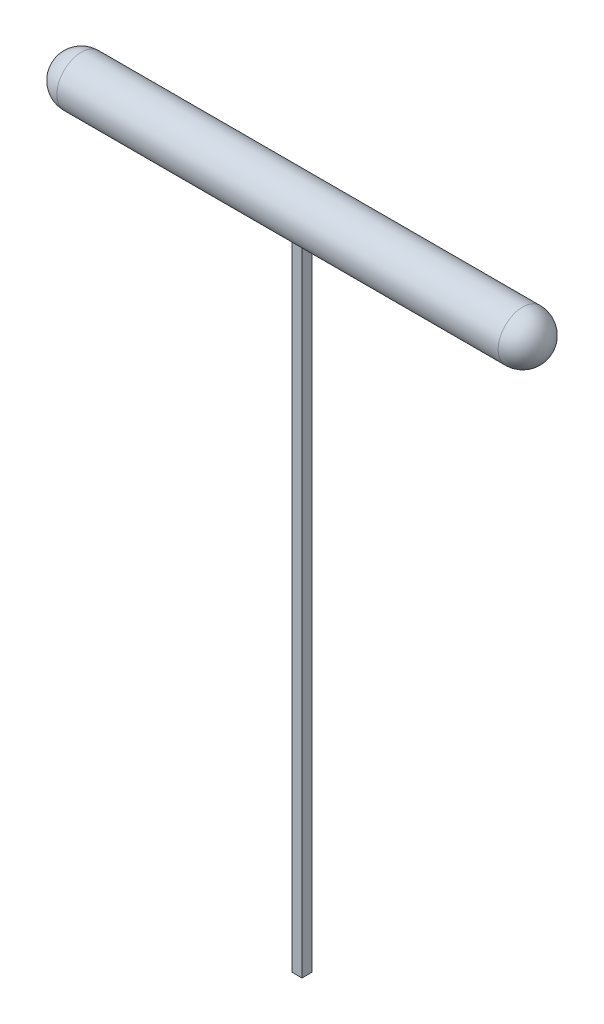
from build123d import *

# Parameters (mm, degrees)
SKETCH1_4_W         = 1
SKETCH1_4_H         = 65
BOSS_EXTRUDE1_DEPTH = 0.5


with BuildPart() as part:
    # Sketch1 → Revolve1 (revolve)
    with BuildSketch(Plane.XY):
        with BuildLine():
            Line((22.5, 2.5), (-22.5, 2.5))
            ThreePointArc((-22.5, 2.5), (-24.267766953, 1.767766953), (-25, 0))
            Line((-25, 0), (25, 0))
            ThreePointArc((25, 0), (24.267766953, 1.767766953), (22.5, 2.5))
        make_face()
    revolve(axis=Axis((-25, 0, 0), (1, 0, 0)))


with BuildPart() as body_2:
    # Sketch1<4> → Boss-Extrude1 (new, symmetric)
    with BuildSketch(Plane.XY):
        with Locations((0, -35)):
            Rectangle(SKETCH1_4_W, SKETCH1_4_H)
    extrude(amount=BOSS_EXTRUDE1_DEPTH, both=True)


solid = Compound([part.part, body_2.part])
